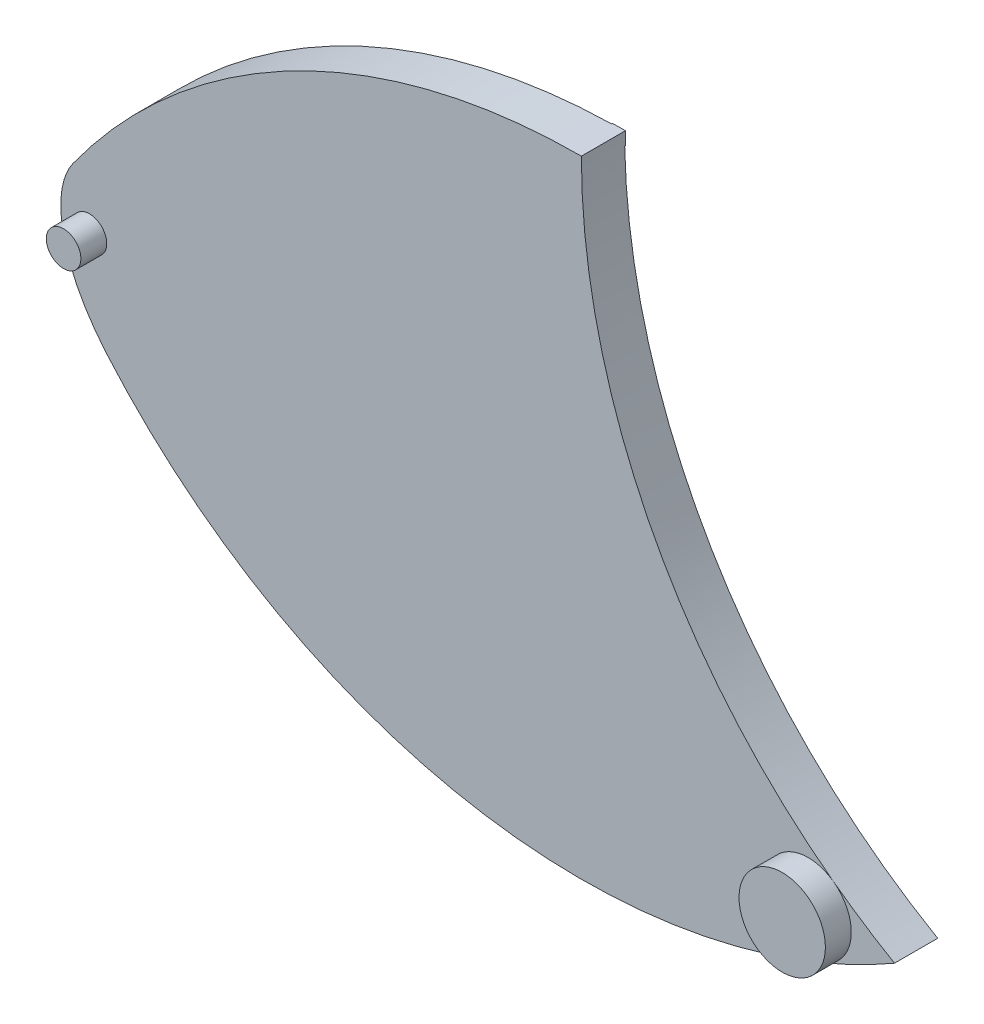
from build123d import *

# Parameters (mm, degrees)
ESTRUSIONE_ESTRUSIONE1_DEPTH = 5
SCHIZZO2_R                   = 2
ESTRUSIONE_ESTRUSIONE3_DEPTH = 3
SCHIZZO3_R                   = 2.25
TAGLIO_ESTRUSIONE2_DEPTH     = 5
SCHIZZO4_R                   = 5
ESTRUSIONE_ESTRUSIONE4_DEPTH = 3
ESTRUSIONE_ESTRUSIONE5_START = -5.1
ESTRUSIONE_ESTRUSIONE5_DEPTH = 0.1


with BuildPart() as part:
    # Schizzo1 → Estrusione-Estrusione1 (new body)
    with BuildSketch(Plane.XY):
        with BuildLine():
            ThreePointArc((-62.786841774, -36.25), (-36.25, -9.713158226), (0, 0))
            ThreePointArc((0, 0), (9.713158226, -36.25), (36.25, -62.786841774))
            ThreePointArc((36.25, -62.786841774), (-18.76438077, -70.029622406), (-62.786841774, -36.25))
        make_face()
    extrude(amount=ESTRUSIONE_ESTRUSIONE1_DEPTH)

    # Schizzo2 → Estrusione-Estrusione3 (add)
    with BuildSketch(Plane.XY.offset(5)):
        with Locations(Location((-56.94020987, -36.25, 0), (0, 0, 180))):
            Circle(SCHIZZO2_R)
    extrude(amount=ESTRUSIONE_ESTRUSIONE3_DEPTH)

    # Schizzo3 → Taglio-Estrusione2 (cut)
    with BuildSketch(Plane.XY.offset(5)):
        with Locations((26.25, -62.186714819)):
            Circle(SCHIZZO3_R)
    extrude(amount=-TAGLIO_ESTRUSIONE2_DEPTH, mode=Mode.SUBTRACT)

    # Raccordo2
    # an asymmetric fillet: 16, 12 mm, written as the material it takes off along each edge
    with BuildSketch(Plane(origin=(-62.786841774, -36.25, -33.900186603), x_dir=(0.5787975585185353, -0.8154712663564442, 0), z_dir=(0, 0, 1))) as raccordo2_piece_1:
        with BuildLine():
            Bezier((13.560074641, 0), (0.046255616, -1.269344794), (-2.702341636, 6.773027618), weights=[1, 0.785330936, 1])
            ThreePointArc((-2.702341636, 6.773027618), (-1.43638067, 3.35251629), (0, 0))
            ThreePointArc((0, 0), (6.780037321, -0.317723131), (13.560074641, 0))
        make_face()
    extrude(amount=72.800373207, mode=Mode.SUBTRACT)

    # Schizzo4 → Estrusione-Estrusione4 (add)
    with BuildSketch(Plane.XY.offset(5)):
        with Locations(Location((26.25, -62.186714819, 0), (0, 0, 292.885380476))):
            Circle(SCHIZZO4_R)
    extrude(amount=ESTRUSIONE_ESTRUSIONE4_DEPTH)

    # Schizzo5 → Estrusione-Estrusione5 (add)
    with BuildSketch(Plane.XY.offset(5).offset(ESTRUSIONE_ESTRUSIONE5_START)):
        with BuildLine():
            ThreePointArc((-1.499919736, -0.015517241), (-1.04963107, -1.071575763), (0.015517241, -1.499919736))
            ThreePointArc((0.015517241, -1.499919736), (0.003879414, -0.75), (0, 0))
            ThreePointArc((0, 0), (-0.75, -0.003879414), (-1.499919736, -0.015517241))
        make_face()
    extrude(amount=ESTRUSIONE_ESTRUSIONE5_DEPTH)


solid = part.part
